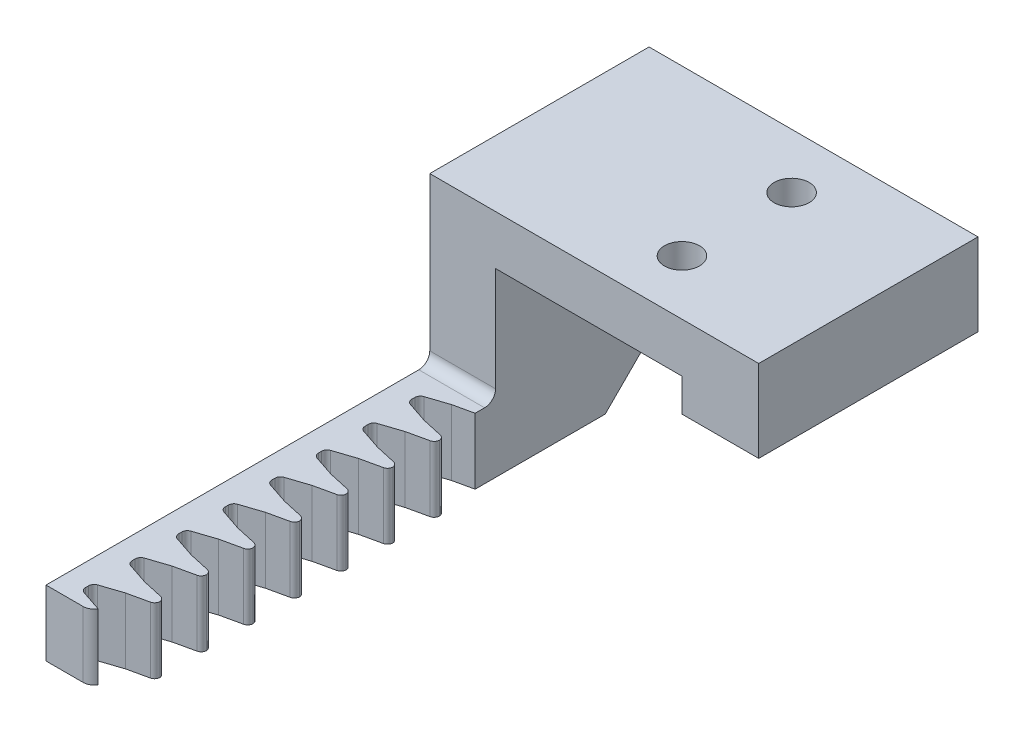
from build123d import *

# Parameters (mm, degrees)
SKETCH1_W           = 30
SKETCH1_H           = 16
BOSS_EXTRUDE1_DEPTH = 20
CUT_EXTRUDE1_START  = -20
CUT_EXTRUDE1_DEPTH  = 20
SKETCH3_W           = 6
SKETCH3_H           = 10
BOSS_EXTRUDE2_DEPTH = 5
SKETCH9_R           = 1.6
CUT_EXTRUDE3_DEPTH  = 4.5
SKETCH11_W          = 8
SKETCH11_H          = 6
BOSS_EXTRUDE4_DEPTH = 40
FILLET1_R           = 1
CUT_EXTRUDE4_START  = -6
CUT_EXTRUDE4_DEPTH  = 6
SKETCH13_W          = 2
SKETCH13_H          = 6
BOSS_EXTRUDE5_DEPTH = 10
LPATTERN1_COUNT     = 8
LPATTERN1_PITCH     = 4.25
FILLET2_R           = 0.5
FILLET3_R           = 1
SKETCH14_W          = 2
SKETCH14_H          = 6
CUT_EXTRUDE5_DEPTH  = 17
CHAMFER9_SIZE       = 5


# Read off the part's stored shape, not the designer's step: Cut-Extrude1, Cut-Extrude4
with BuildPart() as part:
    # Sketch1 → Boss-Extrude1 (new body)
    with BuildSketch(Plane.XY):
        with Locations((15, -8)):
            Rectangle(SKETCH1_W, SKETCH1_H)
    extrude(amount=BOSS_EXTRUDE1_DEPTH)

    # Cut-Extrude1 outline → Cut-Extrude1 (cut)
    with BuildSketch(Plane.XY.offset(20).offset(CUT_EXTRUDE1_START)):
        Polygon((6, -4.5), (6, -16), (30, -16), (30, -7.5), (23, -7.5), (23, -4.5), align=None)
    extrude(amount=CUT_EXTRUDE1_DEPTH, mode=Mode.SUBTRACT)

    # Sketch3 → Boss-Extrude2 (add)
    with BuildSketch(Plane.XZ.offset(16)):
        with Locations((3, 10)):
            Rectangle(SKETCH3_W, SKETCH3_H)
    extrude(amount=BOSS_EXTRUDE2_DEPTH)

    # Sketch9 → Cut-Extrude3 (cut)
    with BuildSketch(Plane.XZ.offset(4.5)):
        with Locations(Location((18, 15, 0), (0, 0, 270))):
            Circle(SKETCH9_R)
        with Locations(Location((18, 5, 0), (0, 0, 270))):
            Circle(SKETCH9_R)
    extrude(amount=-CUT_EXTRUDE3_DEPTH, mode=Mode.SUBTRACT)

    # Sketch11 → Boss-Extrude4 (add)
    with BuildSketch(Plane.XY.offset(15)):
        with Locations((4, -18)):
            Rectangle(SKETCH11_W, SKETCH11_H)
    extrude(amount=BOSS_EXTRUDE4_DEPTH)

    # Fillet1
    fillet1_edges = [part.edges().sort_by_distance(p)[0] for p in [
        (3, -15, 20),
    ]]
    fillet(fillet1_edges, radius=FILLET1_R)

    # Cut-Extrude4 outline → Cut-Extrude4 (cut)
    with BuildSketch(Plane.XZ.offset(21).offset(CUT_EXTRUDE4_START)):
        Polygon((6.5, 51.5), (6.5, 50.75), (8, 50.75), (8, 55), (6.5, 55), (4.25, 54.5), (2, 53.75), (2, 52.75), (4.25, 52), align=None)
    cut_extrude4 = extrude(amount=CUT_EXTRUDE4_DEPTH, mode=Mode.SUBTRACT)

    # Sketch13 → Boss-Extrude5 (add)
    with BuildSketch(Plane(origin=(0, 0, 15), x_dir=(-1, 0, 0), z_dir=(0, 0, -1))):
        with Locations((-7, -18)):
            Rectangle(SKETCH13_W, SKETCH13_H)
    extrude(amount=BOSS_EXTRUDE5_DEPTH)

    # LPattern1: Cut-Extrude4 ×8
    with Locations(*[(0, 0, -i * LPATTERN1_PITCH) for i in range(1, LPATTERN1_COUNT)]):
        add(cut_extrude4, mode=Mode.SUBTRACT)

    # Fillet2
    # the kernel refuses this fillet: 0.5 mm, written as the material it adds along each edge
    with BuildSketch(Plane(origin=(2, -15, 52.75), x_dir=(0.9486832980505131, 0, -0.3162277660168398), z_dir=(0, -1, 0)), Plane(origin=(2, -15, 53.75), x_dir=(0, 0, -1), z_dir=(0, -1, 0)), Plane(origin=(2, -15, 48.5), x_dir=(0.9486832980505137, 0, -0.3162277660168381), z_dir=(0, -1, 0)), Plane(origin=(2, -15, 49.5), x_dir=(0, 0, -1), z_dir=(0, -1, 0)), Plane(origin=(2, -15, 44.25), x_dir=(0.9486832980505137, 0, -0.3162277660168381), z_dir=(0, -1, 0)), Plane(origin=(2, -15, 35.75), x_dir=(0.948683298050514, 0, -0.316227766016837), z_dir=(0, -1, 0)), Plane(origin=(2, -15, 36.75), x_dir=(0, 0, -1), z_dir=(0, -1, 0)), Plane(origin=(2, -15, 40), x_dir=(0.9486832980505137, 0, -0.31622776601683833), z_dir=(0, -1, 0)), Plane(origin=(2, -15, 41), x_dir=(0, 0, -1), z_dir=(0, -1, 0)), Plane(origin=(2, -15, 23), x_dir=(0.9486832980505137, 0, -0.31622776601683833), z_dir=(0, -1, 0)), Plane(origin=(2, -15, 24), x_dir=(0, 0, -1), z_dir=(0, -1, 0)), Plane(origin=(2, -15, 27.25), x_dir=(0.9486832980505135, 0, -0.3162277660168391), z_dir=(0, -1, 0)), Plane(origin=(2, -15, 28.25), x_dir=(0, 0, -1), z_dir=(0, -1, 0)), Plane(origin=(2, -15, 32.5), x_dir=(0, 0, -1), z_dir=(0, -1, 0)), Plane(origin=(2, -15, 31.5), x_dir=(0.9486832980505139, 0, -0.3162277660168378), z_dir=(0, -1, 0))) as fillet2_piece_1:
        with BuildLine():
            CenterArc((FILLET2_R * 0.720759220056, FILLET2_R), FILLET2_R, 198.434948823, 71.565051177)
            Line((-FILLET2_R * 0.227924077994, FILLET2_R * 0.683772233983), (0, 0))
            Line((0, 0), (FILLET2_R * 0.720759220056, 0))
        make_face()
    extrude(amount=6)
    with BuildSketch(Plane(origin=(2, -15, 45.25), x_dir=(0.948683298050513, 0, 0.31622776601684033), z_dir=(0, -1, 0))) as fillet2_piece_2:
        with BuildLine():
            CenterArc((FILLET2_R * 0.720759220056, -FILLET2_R), FILLET2_R, 90, 71.565051177)
            Line((-FILLET2_R * 0.227924077994, -FILLET2_R * 0.683772233983), (0, 0))
            Line((0, 0), (FILLET2_R * 0.720759220056, 0))
        make_face()
    extrude(amount=6)
    # the kernel refuses this fillet: 0.5 mm, written as the material it takes off along each edge
    with BuildSketch(Plane(origin=(6.5, -13.997285492, 33.75), x_dir=(-0.9761870601839541, 0, -0.21693045781865056), z_dir=(0, -1, 0)), Plane(origin=(6.5, -13.997285492, 34.5), x_dir=(0, 0, -1), z_dir=(0, -1, 0)), Plane(origin=(6.5, -13.997285492, 38), x_dir=(-0.9761870601839538, 0, -0.216930457818651), z_dir=(0, -1, 0)), Plane(origin=(6.5, -13.997285492, 38.75), x_dir=(0, 0, -1), z_dir=(0, -1, 0)), Plane(origin=(6.5, -13.997285492, 42.25), x_dir=(-0.9761870601839541, 0, -0.21693045781865006), z_dir=(0, -1, 0)), Plane(origin=(6.5, -13.997285492, 43), x_dir=(0, 0, -1), z_dir=(0, -1, 0)), Plane(origin=(6.5, -13.997285492, 46.5), x_dir=(-0.9761870601839537, 0, -0.21693045781865147), z_dir=(0, -1, 0)), Plane(origin=(6.5, -13.997285492, 47.25), x_dir=(0, 0, -1), z_dir=(0, -1, 0)), Plane(origin=(6.5, -13.997285492, 50.75), x_dir=(-0.9761870601839537, 0, -0.21693045781865147), z_dir=(0, -1, 0)), Plane(origin=(6.5, -13.997285492, 51.5), x_dir=(0, 0, -1), z_dir=(0, -1, 0)), Plane(origin=(6.5, -13.997285492, 25.25), x_dir=(-0.9761870601839521, 0, -0.21693045781865947), z_dir=(0, -1, 0)), Plane(origin=(6.5, -13.997285492, 26), x_dir=(0, 0, -1), z_dir=(0, -1, 0)), Plane(origin=(6.5, -13.997285492, 29.5), x_dir=(-0.9761870601839522, 0, -0.2169304578186585), z_dir=(0, -1, 0)), Plane(origin=(6.5, -13.997285492, 30.25), x_dir=(0, 0, -1), z_dir=(0, -1, 0))) as fillet2_2_piece_1:
        with BuildLine():
            CenterArc((FILLET2_R * 0.802171606366, -FILLET2_R), FILLET2_R, 90, 77.471192291)
            Line((-FILLET2_R * 0.174015453818, -FILLET2_R * 0.783069542181), (0, 0))
            Line((0, 0), (FILLET2_R * 0.802171606366, 0))
        make_face()
    extrude(amount=8.005429016, mode=Mode.SUBTRACT)

    # Fillet3
    # the kernel refuses this fillet: 1 mm, written as the material it takes off along each edge
    with BuildSketch(Plane(origin=(6.5, -7.209936491, 55), x_dir=(-0.9761870601839528, 0, -0.21693045781865575), z_dir=(0, -1, 0))) as fillet3_piece_1:
        with BuildLine():
            CenterArc((3.258754136, 0.300226243), FILLET3_R, 197.471192291, 60)
            Line((3.041823678, -0.675960817), (0, 0))
            Line((0, 0), (2.304886114, 0))
        make_face()
    extrude(amount=21.580127019, mode=Mode.SUBTRACT)

    # Sketch14 → Cut-Extrude5 (cut)
    with BuildSketch(Plane(origin=(0, 0, 5), x_dir=(-1, 0, 0), z_dir=(0, 0, -1))):
        with Locations((-7, -18)):
            Rectangle(SKETCH14_W, SKETCH14_H)
    extrude(amount=-CUT_EXTRUDE5_DEPTH, mode=Mode.SUBTRACT)

    # Chamfer9
    # the kernel refuses this chamfer: 5 mm, written as the material it adds along each edge
    # the kernel refuses this chamfer: 5 mm, written as the material it takes off along each edge
    with BuildSketch(Plane(origin=(18.85841494, -21, 5), x_dir=(0, -0.027495876610586393, 0.9996219169112968), z_dir=(-1, 0, 0))) as chamfer9_2_piece_1:
        Polygon((CHAMFER9_SIZE * 0.999621916911, CHAMFER9_SIZE * 0.0274958766106), (-CHAMFER9_SIZE * 0.0274958766106, CHAMFER9_SIZE * 0.999621916911), (0, 0), align=None)
    extrude(amount=31.71682988, mode=Mode.SUBTRACT)
    with BuildSketch(Plane(origin=(18.85841494, -16, 0), x_dir=(0, 0.9996219169112968, -0.027495876610586372), z_dir=(-1, 0, 0))) as chamfer9_2_piece_2:
        Polygon((CHAMFER9_SIZE * 0.999621916911, -CHAMFER9_SIZE * 0.0274958766106), (-CHAMFER9_SIZE * 0.0274958766106, -CHAMFER9_SIZE * 0.999621916911), (0, 0), align=None)
    extrude(amount=31.71682988, mode=Mode.SUBTRACT)


solid = part.part
